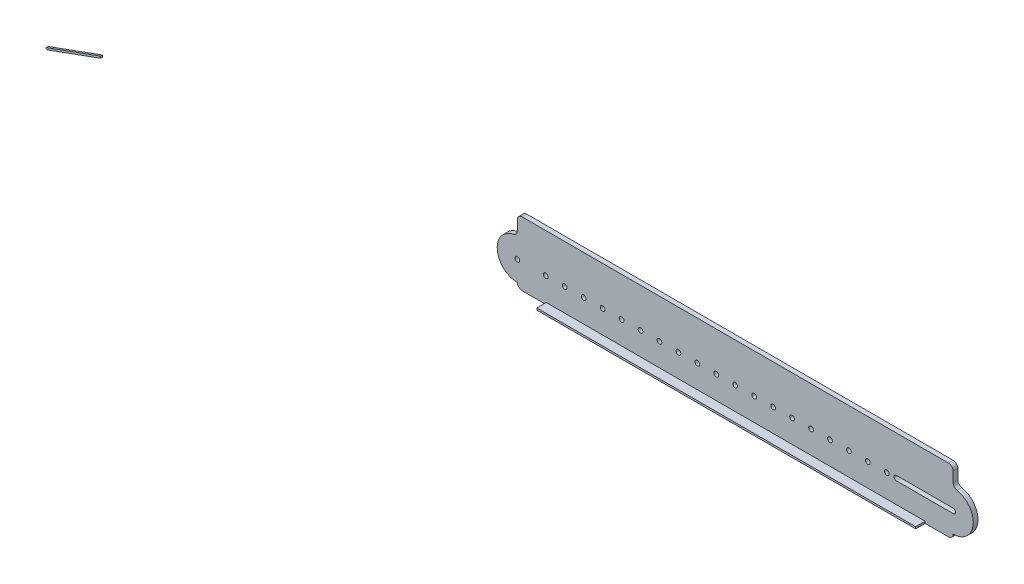
from build123d import *

# Parameters (mm, degrees)
SKETCH1_W           = 584.2
SKETCH1_H           = 25.4
SKETCH1_H_2         = 6.35
BOSS_EXTRUDE1_DEPTH = 3.175
SKETCH2_R           = 3.175
CUT_EXTRUDE1_DEPTH  = 614.461435473
FILLET1_R           = 6.35
SKETCH3_W           = 508
SKETCH3_H           = 12.7
BOSS_EXTRUDE2_DEPTH = 2.54
BOSS_EXTRUDE3_DEPTH = 2.54


with BuildPart() as part:
    # Sketch1 → Boss-Extrude1 (new, symmetric)
    with BuildSketch(Plane.XY):
        with Locations((292.1, 39.6875)):
            Rectangle(SKETCH1_W, SKETCH1_H)
        with BuildLine():
            Line((0, -26.9875), (584.2, -26.9875))
            ThreePointArc((584.2, -26.9875), (611.1875, 0), (584.2, 26.9875))
            Line((584.2, 26.9875), (0, 26.9875))
            ThreePointArc((0, 26.9875), (-26.9875, 0), (0, -26.9875))
        make_face()
        with Locations((292.1, -30.1625)):
            Rectangle(SKETCH1_W, SKETCH1_H_2)
    extrude(amount=BOSS_EXTRUDE1_DEPTH, both=True)

    # Sketch2 → Cut-Extrude1 (cut, through all)
    with BuildSketch(Plane.XY.offset(3.175)):
        Circle(SKETCH2_R)
        with Locations((38.1, 0)):
            Circle(SKETCH2_R)
        with Locations((63.5, 0)):
            Circle(SKETCH2_R)
        with Locations((88.9, 0)):
            Circle(SKETCH2_R)
        with Locations((114.3, 0)):
            Circle(SKETCH2_R)
        with Locations((139.7, 0)):
            Circle(SKETCH2_R)
        with Locations((165.1, 0)):
            Circle(SKETCH2_R)
        with Locations((190.5, 0)):
            Circle(SKETCH2_R)
        with Locations((215.9, 0)):
            Circle(SKETCH2_R)
        with Locations((241.3, 0)):
            Circle(SKETCH2_R)
        with Locations((266.7, 0)):
            Circle(SKETCH2_R)
        with Locations((292.1, 0)):
            Circle(SKETCH2_R)
        with Locations((317.5, 0)):
            Circle(SKETCH2_R)
        with Locations((342.9, 0)):
            Circle(SKETCH2_R)
        with Locations((368.3, 0)):
            Circle(SKETCH2_R)
        with Locations((393.7, 0)):
            Circle(SKETCH2_R)
        with Locations((419.1, 0)):
            Circle(SKETCH2_R)
        with Locations((444.5, 0)):
            Circle(SKETCH2_R)
        with Locations((469.9, 0)):
            Circle(SKETCH2_R)
        with Locations((495.3, 0)):
            Circle(SKETCH2_R)
        with BuildLine():
            Line((508, 3.175), (584.2, 3.175))
            ThreePointArc((584.2, 3.175), (587.375, 0), (584.2, -3.175))
            Line((584.2, -3.175), (508, -3.175))
            ThreePointArc((508, -3.175), (504.825, 0), (508, 3.175))
        make_face()
    extrude(amount=-CUT_EXTRUDE1_DEPTH, mode=Mode.SUBTRACT)

    # Fillet1
    fillet1_edges = [part.edges().sort_by_distance(p)[0] for p in [
        (584.2, 52.3875, 0),
        (584.2, 26.9875, 0),
        (0, 26.9875, 0),
        (0, 52.3875, 0),
        (0, -33.3375, 0),
        (584.2, -33.3375, 0),
    ]]
    fillet(fillet1_edges, radius=FILLET1_R - 0.0001)  # a hair under: the kernel refuses the full size

    # Sketch3 → Boss-Extrude2 (add)
    with BuildSketch(Plane(origin=(0, -33.3375, 0), x_dir=(1, 0, 0), z_dir=(0, 1, 0))):
        with Locations((292.707005311, -9.525)):
            Rectangle(SKETCH3_W, SKETCH3_H)
    extrude(amount=BOSS_EXTRUDE2_DEPTH)


with BuildPart() as body_2:
    # Sketch4 → Boss-Extrude3 (new body)
    with BuildSketch(Plane.XY.offset(15.875)):
        with BuildLine():
            Line((-546.1, -30.7975), (-546.1, -33.3375))
            Line((-546.1, -33.3375), (-617.574427312, -59.352064053))
            ThreePointArc((-617.574427312, -59.352064053), (-619.104035665, -58.638795963), (-618.390767576, -57.10918761))
            Line((-618.390767576, -57.10918761), (-546.1, -30.7975))
        make_face()
    extrude(amount=-BOSS_EXTRUDE3_DEPTH)


solid = Compound([part.part, body_2.part])
